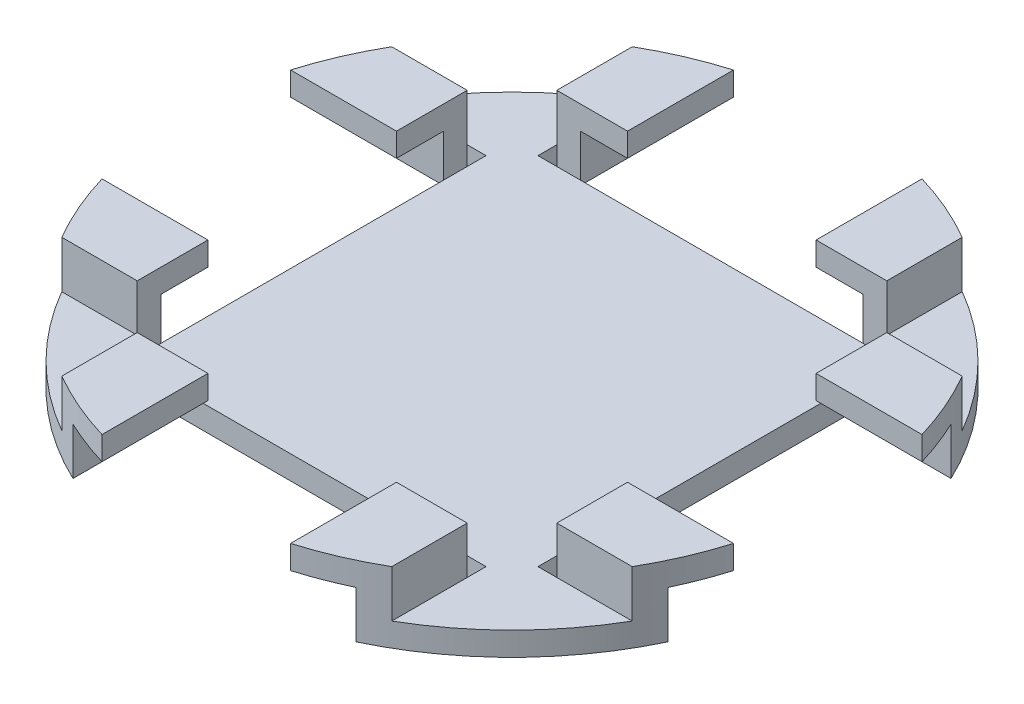
from build123d import *

# Parameters (mm, degrees)
SKETCH1_R          = 88.773
BASE_DEPTH         = 6.35
STOPPER_DEPTH      = 12.7
STOPPER_START      = -6.35
STOPPER_GAP_DEPTH  = 121.63107559
OVERHANG_START     = -26.416
OVERHANG_CUT_DEPTH = 26.416
CIRPATTERN1_COUNT  = 4


with BuildPart() as part:
    # Sketch1 → Base (new body)
    with BuildSketch(Plane(origin=(0, 0, 0), x_dir=(1, 0, 0), z_dir=(0, 1, 0))):
        Circle(SKETCH1_R)
    extrude(amount=BASE_DEPTH)

    # Sketch2 → Stopper (add)
    with BuildSketch(Plane(origin=(0, 6.35, 0), x_dir=(1, 0, 0), z_dir=(0, 1, 0))):
        with BuildLine():
            Line((-44.45, -76.842976445), (-44.45, -51.442976445))
            Line((-44.45, -51.442976445), (0, -51.442976445))
            Line((0, -51.442976445), (44.45, -51.442976445))
            Line((44.45, -51.442976445), (44.45, -76.842976445))
            ThreePointArc((44.45, -76.842976445), (23.011562105, -85.73863504), (0, -88.773))
            ThreePointArc((0, -88.773), (-23.011562105, -85.73863504), (-44.45, -76.842976445))
        make_face()
    stopper = extrude(amount=STOPPER_DEPTH)

    # Sketch5 → Stopper Gap (cut, through all)
    with BuildSketch(Plane(origin=(0, 19.05, 0), x_dir=(1, 0, 0), z_dir=(0, 1, 0)).offset(STOPPER_START)):
        with BuildLine():
            Line((-38.10000012, -80.181266639), (-38.10000012, -51.442976445))
            Line((-38.10000012, -51.442976445), (-1.2e-07, -51.442976445))
            Line((-1.2e-07, -51.442976445), (38.09999988, -51.442976445))
            Line((38.09999988, -51.442976445), (38.10000012, -80.181266639))
            ThreePointArc((38.10000012, -80.181266639), (19.528363291, -86.598432758), (0, -88.773))
            ThreePointArc((0, -88.773), (-19.528363291, -86.598432758), (-38.10000012, -80.181266639))
        make_face()
    stopper_gap = extrude(amount=-STOPPER_GAP_DEPTH, mode=Mode.SUBTRACT)

    # Sketch6 → Overhang cut (cut)
    with BuildSketch(Plane(origin=(0, 19.05, 0), x_dir=(1, 0, 0), z_dir=(0, 1, 0)).offset(OVERHANG_START)):
        with BuildLine():
            Line((-25.4, -51.442976445), (0, -51.442976445))
            Line((0, -51.442976445), (25.4, -51.442976445))
            Line((25.4, -51.442976445), (44.45, -51.442976445))
            Line((44.45, -51.442976445), (44.45, -56.522976445))
            Line((44.45, -56.522976445), (25.4, -56.522976445))
            Line((25.4, -56.522976445), (25.4, -85.06165722))
            ThreePointArc((25.4, -85.06165722), (12.834855523, -87.840264188), (0, -88.773))
            ThreePointArc((0, -88.773), (-12.834855523, -87.840264188), (-25.4, -85.06165722))
            Line((-25.4, -85.06165722), (-25.4, -56.522976445))
            Line((-25.4, -56.522976445), (-44.45, -56.522976445))
            Line((-44.45, -56.522976445), (-44.45, -51.442976445))
            Line((-44.45, -51.442976445), (-25.4, -51.442976445))
        make_face()
    overhang_cut = extrude(amount=OVERHANG_CUT_DEPTH, mode=Mode.SUBTRACT)

    # CirPattern1: Stopper, Stopper Gap, Overhang cut ×4 about axis
    cirpattern1_axis = Axis((0, 6.35, 0), (0, 1, 0))
    add([stopper.rotate(cirpattern1_axis, i * 360 / CIRPATTERN1_COUNT) for i in range(1, CIRPATTERN1_COUNT)])
    add([stopper_gap.rotate(cirpattern1_axis, i * 360 / CIRPATTERN1_COUNT) for i in range(1, CIRPATTERN1_COUNT)], mode=Mode.SUBTRACT)
    add([overhang_cut.rotate(cirpattern1_axis, i * 360 / CIRPATTERN1_COUNT) for i in range(1, CIRPATTERN1_COUNT)], mode=Mode.SUBTRACT)


solid = part.part
